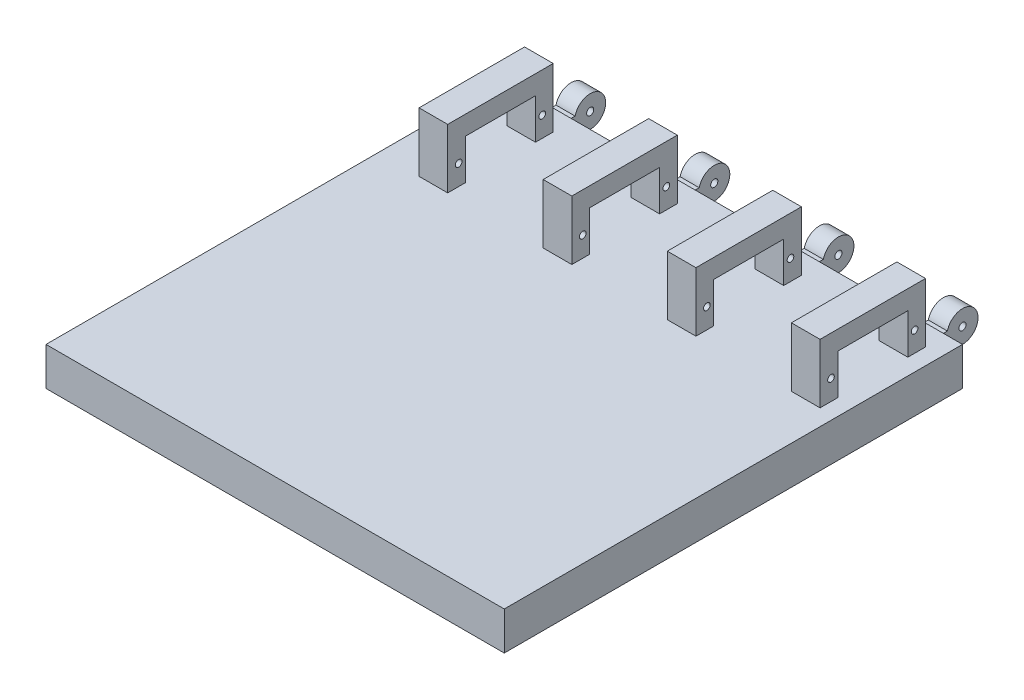
from build123d import *

# Parameters (mm, degrees)
SKETCH2_W           = 152.4
SKETCH2_H           = 152.4
BOSS_EXTRUDE2_DEPTH = 12.7
SKETCH3_R           = 1.19126
BOSS_EXTRUDE3_DEPTH = 6.35
SKETCH4_R           = 1.09982
BOSS_EXTRUDE4_DEPTH = 9.525
LPATTERN1_COUNT     = 4
LPATTERN1_PITCH     = 41.275


with BuildPart() as part:
    # Sketch2 → Boss-Extrude2 (new body)
    with BuildSketch(Plane(origin=(0, 0, 0), x_dir=(1, 0, 0), z_dir=(0, 1, 0))):
        with Locations((-76.2, -76.2)):
            Rectangle(SKETCH2_W, SKETCH2_H)
    extrude(amount=BOSS_EXTRUDE2_DEPTH)

    # Sketch3 → Boss-Extrude3 (add)
    with BuildSketch(Plane(origin=(-12.7, 0, 0), x_dir=(0, 0, -1), z_dir=(1, 0, 0))):
        with BuildLine():
            Line((7.683901915, 6.35), (0, 6.35))
            Line((0, 6.35), (0, 0))
            Line((0, 0), (12.7, 0))
            ThreePointArc((12.7, 0), (16.74610121, 8.352363863), (7.683901915, 6.35))
        make_face()
        with Locations((12.7, 5.1562)):
            Circle(SKETCH3_R, mode=Mode.SUBTRACT)
    boss_extrude3 = extrude(amount=-BOSS_EXTRUDE3_DEPTH)

    # Sketch4 → Boss-Extrude4 (add)
    with BuildSketch(Plane(origin=(-14.93266, 0, 0), x_dir=(0, 0, -1), z_dir=(1, 0, 0))):
        Polygon((-6.89102, 12.7), (-6.89102, 32.440245), (-41.971595, 32.440245), (-41.971595, 12.7), (-36.0778425, 12.7), (-36.0778425, 26.090245), (-12.7847725, 26.090245), (-12.7847725, 12.7), align=None)
        with Locations((-10.5324402, 19.3964052)):
            Circle(SKETCH4_R, mode=Mode.SUBTRACT)
        with Locations((-38.332740173, 19.39518138)):
            Circle(SKETCH4_R, mode=Mode.SUBTRACT)
    boss_extrude4 = extrude(amount=BOSS_EXTRUDE4_DEPTH)

    # LPattern1: Boss-Extrude3, Boss-Extrude4 ×4
    with Locations(*[(-i * LPATTERN1_PITCH, 0, 0) for i in range(1, LPATTERN1_COUNT)]):
        add(boss_extrude3)
        add(boss_extrude4)


solid = part.part
